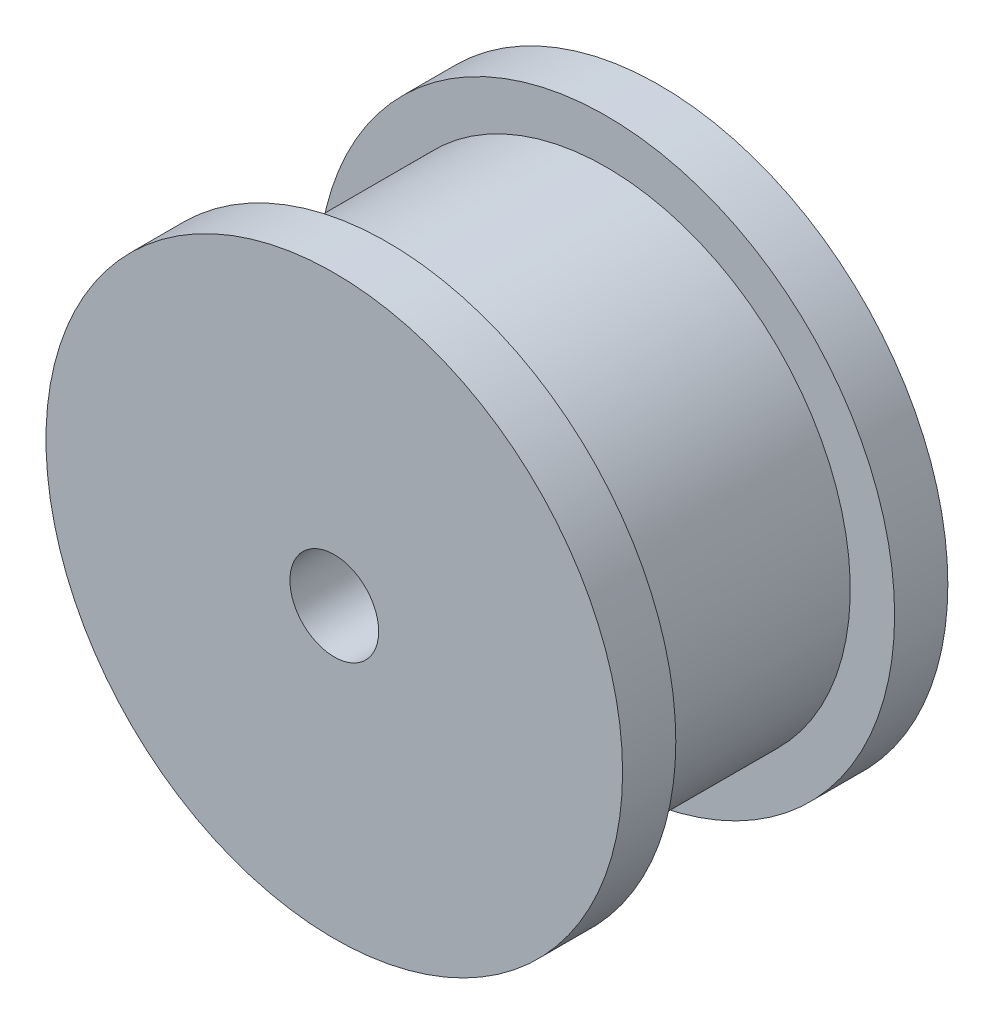
from build123d import *

# Parameters (mm, degrees)
SKETCH1_R               = 16.5
SKETCH1_R_2             = 12.5
BOSS_EXTRUDE1_DEPTH     = 7.4
SKETCH6_R               = 19.5
SKETCH6_R_2             = 12.5
BOSS_EXTRUDE2_DEPTH     = 3.6
SKETCH12_R              = 12.5
SKETCH12_R_2            = 1.5
BOSS_EXTRUDE4_DEPTH     = 18.4
CHAMFER3_SIZE           = 3.6
CUT_EXTRUDE1_DEPTH      = 35.662660025
CUT_EXTRUDE1_DEPTH_BACK = 35.662660025
SKETCH14_R              = 3


with BuildPart() as part:
    # Sketch1 → Boss-Extrude1 (new, symmetric)
    with BuildSketch(Plane.XY):
        Circle(SKETCH1_R)
        Circle(SKETCH1_R_2, mode=Mode.SUBTRACT)
    extrude(amount=BOSS_EXTRUDE1_DEPTH, both=True)

    # Sketch6 → Boss-Extrude2 (add)
    with BuildSketch(Plane.XY.offset(7.4)):
        Circle(SKETCH6_R)
        Circle(SKETCH6_R_2, mode=Mode.SUBTRACT)
    boss_extrude2 = extrude(amount=BOSS_EXTRUDE2_DEPTH)

    # Mirror1: Boss-Extrude2 across plane
    add(boss_extrude2.mirror(Plane.XY))

    # Sketch12 → Boss-Extrude4 (add)
    with BuildSketch(Plane.XY.offset(11)):
        with Locations(Location((0, 0, 0), (0, 0, 180))):
            Circle(SKETCH12_R)
        Circle(SKETCH12_R_2, mode=Mode.SUBTRACT)
    extrude(amount=-BOSS_EXTRUDE4_DEPTH)

    # Chamfer3
    chamfer3_edges = [part.edges().sort_by_distance(p)[0] for p in [
        (-12.5, 0, -7.4),
    ]]
    chamfer(chamfer3_edges, length=CHAMFER3_SIZE - 0.0001)  # a hair under: the kernel refuses the full size

    # Fillet3: read off the stored shape, not the designer's step
    # Fillet3 outline → Fillet3 (revolve, cut)
    with BuildSketch(Plane.XZ):
        with BuildLine():
            Line((11.914213562, -11), (13.328427125, -11))
            ThreePointArc((13.328427125, -11), (12.56306026, -10.847759065), (11.914213562, -10.414213562))
            Line((11.914213562, -10.414213562), (11.914213562, -11))
        make_face()
    revolve(axis=Axis((0, 0, 0), (0, 0, 1)), mode=Mode.SUBTRACT)

    # Fillet3 2 outline → Fillet3 2 (revolve)
    with BuildSketch(Plane.XZ):
        with BuildLine():
            ThreePointArc((8.071572875, -7.4), (8.83693974, -7.552240935), (9.485786438, -7.985786438))
            Line((9.485786438, -7.985786438), (9.485786438, -7.4))
            Line((9.485786438, -7.4), (8.071572875, -7.4))
        make_face()
    revolve(axis=Axis((0, 0, 0), (0, 0, 1)))

    # Sketch14 → Cut-Extrude1 (cut, two sides: drawn at the far end of the back side and taken through both)
    with BuildSketch(Plane.XY.offset(-10).offset(-CUT_EXTRUDE1_DEPTH_BACK)):
        Circle(SKETCH14_R)
    extrude(amount=CUT_EXTRUDE1_DEPTH + CUT_EXTRUDE1_DEPTH_BACK, mode=Mode.SUBTRACT)


solid = part.part
